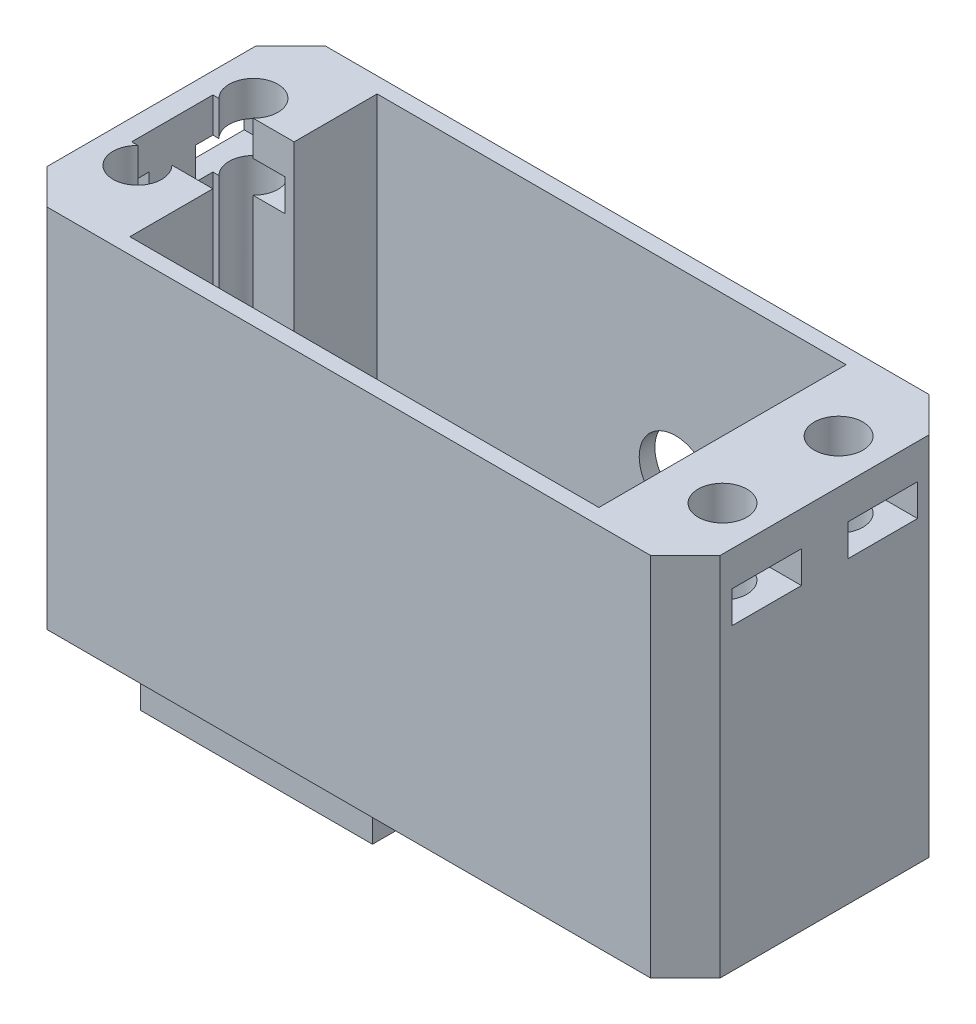
from build123d import *

# Parameters (mm, degrees)
SKETCH1_W           = 58
SKETCH1_H           = 24
SKETCH1_R           = 2.1
SKETCH1_W_2         = 40.4
SKETCH1_H_2         = 21.3
BOSS_EXTRUDE1_DEPTH = 28.35
SKETCH11_W          = 58
SKETCH11_H          = 24
BOSS_EXTRUDE5_DEPTH = 3.175
SKETCH14_W          = 24
SKETCH14_H          = 12
BOSS_EXTRUDE7_DEPTH = 9
CUT_EXTRUDE1_START  = -4.5
CUT_EXTRUDE1_DEPTH  = 7.6
FILLET1_R           = 8
CHAMFER2_SIZE       = 3
CHAMFER3_SIZE       = 1
SKETCH19_W          = 8
SKETCH19_H          = 6
CUT_EXTRUDE3_DEPTH  = 2.75
SKETCH20_W          = 8.8
SKETCH20_H          = 8.5
CUT_EXTRUDE4_DEPTH  = 4
SKETCH21_W          = 20
SKETCH21_H          = 20
BOSS_EXTRUDE8_DEPTH = 6
SKETCH13_R          = 2.55
BOSS_EXTRUDE6_DEPTH = 5
FILLET4_R           = 1
CHAMFER4_SIZE       = 2
FILLET5_R           = 1
CUT_EXTRUDE5_REACH  = 77.835
SKETCH22_W          = 7
SKETCH22_H          = 7
CUT_EXTRUDE6_DEPTH  = 1.4
SKETCH24_R          = 3.125
CUT_EXTRUDE7_DEPTH  = 1.35


with BuildPart() as part:
    # Sketch1 → Boss-Extrude1 (new body)
    with BuildSketch(Plane(origin=(0, 0, 0), x_dir=(1, 0, 0), z_dir=(0, 1, 0))):
        with Locations((29.95, -9.622651473)):
            Rectangle(SKETCH1_W, SKETCH1_H)
        with Locations(Location((55.15, -4.622651473, 0), (0, 0, 270))):
            Circle(SKETCH1_R, mode=Mode.SUBTRACT)
        with Locations(Location((55.15, -14.622651473, 0), (0, 0, 270))):
            Circle(SKETCH1_R, mode=Mode.SUBTRACT)
        with Locations(Location((4.75, -14.622651473, 0), (0, 0, 90))):
            Circle(SKETCH1_R, mode=Mode.SUBTRACT)
        with Locations(Location((4.75, -4.622651473, 0), (0, 0, 90))):
            Circle(SKETCH1_R, mode=Mode.SUBTRACT)
        with Locations((29.95, -9.622651473)):
            Rectangle(SKETCH1_W_2, SKETCH1_H_2, mode=Mode.SUBTRACT)
    extrude(amount=BOSS_EXTRUDE1_DEPTH)

    # Sketch11 → Boss-Extrude5 (add)
    with BuildSketch(Plane.XZ):
        with Locations((29.95, 9.622651473)):
            Rectangle(SKETCH11_W, SKETCH11_H)
    extrude(amount=BOSS_EXTRUDE5_DEPTH)

    # Sketch14 → Boss-Extrude7 (add)
    with BuildSketch(Plane(origin=(0, 0, -2.377348527), x_dir=(-1, 0, 0), z_dir=(0, 0, -1))):
        with Locations((-12.95, 12.5875)):
            Rectangle(SKETCH14_W, SKETCH14_H)
    extrude(amount=BOSS_EXTRUDE7_DEPTH)

    # Sketch16 → Cut-Extrude1 (cut)
    with BuildSketch(Plane(origin=(0, 0, -6.877348527), x_dir=(-1, 0, 0), z_dir=(0, 0, -1)).offset(CUT_EXTRUDE1_START)):
        with BuildLine():
            Line((-11.45, 16.7875), (-24.95, 16.7875))
            Line((-24.95, 16.7875), (-24.95, 8.3875))
            Line((-24.95, 8.3875), (-11.45, 8.3875))
            ThreePointArc((-11.45, 8.3875), (-7.25, 12.5875), (-11.45, 16.7875))
        make_face()
    extrude(amount=CUT_EXTRUDE1_DEPTH, mode=Mode.SUBTRACT)

    # Fillet1
    fillet1_edges = [part.edges().sort_by_distance(p)[0] for p in [
        (12.95, 6.5875, -2.377348527),
        (12.95, 18.5875, -2.377348527),
    ]]
    fillet(fillet1_edges, radius=FILLET1_R)

    # Chamfer2
    chamfer2_edges = [part.edges().sort_by_distance(p)[0] for p in [
        (0.95, 6.5875, -10.877348527),
        (0.95, 18.5875, -10.877348527),
        (58.95, 12.5875, 21.622651473),
        (0.95, 12.5875, 21.622651473),
        (0.95, 27.46875, -2.377348527),
        (58.95, 12.5875, -2.377348527),
        (0.95, -2.29375, -2.377348527),
        (0.95, 4.244354249, -4.720494277),
        (0.95, 20.930645751, -4.720494277),
    ]]
    chamfer(chamfer2_edges, length=CHAMFER2_SIZE)

    # Chamfer3
    chamfer3_edges = [part.edges().sort_by_distance(p)[0] for p in [
        (14.45, 6.5875, -11.377348527),
        (24.95, 12.5875, -11.377348527),
        (14.45, 18.5875, -11.377348527),
        (0.95, 12.5875, -11.377348527),
    ]]
    chamfer(chamfer3_edges, length=CHAMFER3_SIZE - 0.0001)  # a hair under: the kernel refuses the full size

    # Sketch19 → Cut-Extrude3 (cut)
    with BuildSketch(Plane(origin=(0, 25.35, 0), x_dir=(1, 0, 0), z_dir=(0, 1, 0))):
        with Locations((4.95, -4.622651473)):
            Rectangle(SKETCH19_W, SKETCH19_H)
        with Locations((4.95, -14.622651473)):
            Rectangle(SKETCH19_W, SKETCH19_H)
        with Locations((54.95, -14.622651473)):
            Rectangle(SKETCH19_W, SKETCH19_H)
        with Locations((54.95, -4.622651473)):
            Rectangle(SKETCH19_W, SKETCH19_H)
    extrude(amount=-CUT_EXTRUDE3_DEPTH, mode=Mode.SUBTRACT)

    # Sketch20 → Cut-Extrude4 (cut)
    with BuildSketch(Plane(origin=(0, 0, 0), x_dir=(1, 0, 0), z_dir=(0, 1, 0))):
        with Locations((5.35, -9.622651473)):
            Rectangle(SKETCH20_W, SKETCH20_H)
    extrude(amount=CUT_EXTRUDE4_DEPTH, mode=Mode.SUBTRACT)

    # Sketch21 → Boss-Extrude8 (add)
    with BuildSketch(Plane.XZ.offset(3.175)):
        with Locations((20, 9.622651473)):
            Rectangle(SKETCH21_W, SKETCH21_H)
    extrude(amount=BOSS_EXTRUDE8_DEPTH)

    # Sketch13 → Boss-Extrude6 (add)
    with BuildSketch(Plane.XZ.offset(9.175)):
        with Locations(Location((20, 9.622651473, 0), (0, 0, 270))):
            Circle(SKETCH13_R)
    extrude(amount=BOSS_EXTRUDE6_DEPTH)

    # Fillet4
    fillet4_edges = [part.edges().sort_by_distance(p)[0] for p in [
        (10, -3.175, 9.622651473),
        (20, -3.175, -0.377348527),
        (30, -3.175, 9.622651473),
        (20, -3.175, 19.622651473),
    ]]
    fillet(fillet4_edges, radius=FILLET4_R)

    # Chamfer4
    chamfer4_edges = [part.edges().sort_by_distance(p)[0] for p in [
        (10, -9.175, 9.622651473),
        (20, -9.175, -0.377348527),
        (30, -9.175, 9.622651473),
        (20, -9.175, 19.622651473),
    ]]
    chamfer(chamfer4_edges, length=CHAMFER4_SIZE)

    # Fillet5
    fillet5_edges = [part.edges().sort_by_distance(p)[0] for p in [
        (20, -14.175, 12.172651473),
    ]]
    fillet(fillet5_edges, radius=FILLET5_R)

    # Cut-Extrude5: up to this face of the body (flat: up to its plane)
    cut_extrude5_end = Plane(part.part.faces().sort_by_distance((27.49586415, 0, 9.622651473))[0])
    # Sketch22 → Cut-Extrude5 (cut, up to the picked face)
    with BuildSketch(Plane(origin=(0, 28.35, 0), x_dir=(1, 0, 0), z_dir=(0, 1, 0)), mode=Mode.PRIVATE) as cut_extrude5_sk1:
        with Locations((6.25, -9.622651473)):
            Rectangle(SKETCH22_W, SKETCH22_H)
    cut_extrude5_tool1 = split(extrude(cut_extrude5_sk1.sketch, amount=-CUT_EXTRUDE5_REACH, mode=Mode.PRIVATE), bisect_by=cut_extrude5_end, keep=Keep.BOTH, mode=Mode.PRIVATE)
    add(cut_extrude5_tool1.solids().sort_by(Axis((6.25, 28.35, 9.622651), (0, -1, 0)))[0], mode=Mode.SUBTRACT)

    # Sketch23 → Cut-Extrude6 (cut)
    with BuildSketch(Plane(origin=(0, 0, -11.377348527), x_dir=(-1, 0, 0), z_dir=(0, 0, -1))):
        with BuildLine():
            ThreePointArc((-10.2, 12.5875), (-11.45, 13.8375), (-12.7, 12.5875))
            ThreePointArc((-12.7, 12.5875), (-11.45, 11.3375), (-10.2, 12.5875))
        make_face()
        with BuildLine():
            ThreePointArc((-14.2, 12.5875), (-15.45, 13.8375), (-16.7, 12.5875))
            ThreePointArc((-16.7, 12.5875), (-15.45, 11.3375), (-14.2, 12.5875))
        make_face()
    extrude(amount=-CUT_EXTRUDE6_DEPTH, mode=Mode.SUBTRACT)

    # Sketch24 → Cut-Extrude7 (cut)
    with BuildSketch(Plane(origin=(0, 0, -2.377348527), x_dir=(-1, 0, 0), z_dir=(0, 0, -1))):
        with Locations((-35.45, 12.5875)):
            Circle(SKETCH24_R)
    extrude(amount=-CUT_EXTRUDE7_DEPTH, mode=Mode.SUBTRACT)


solid = part.part
